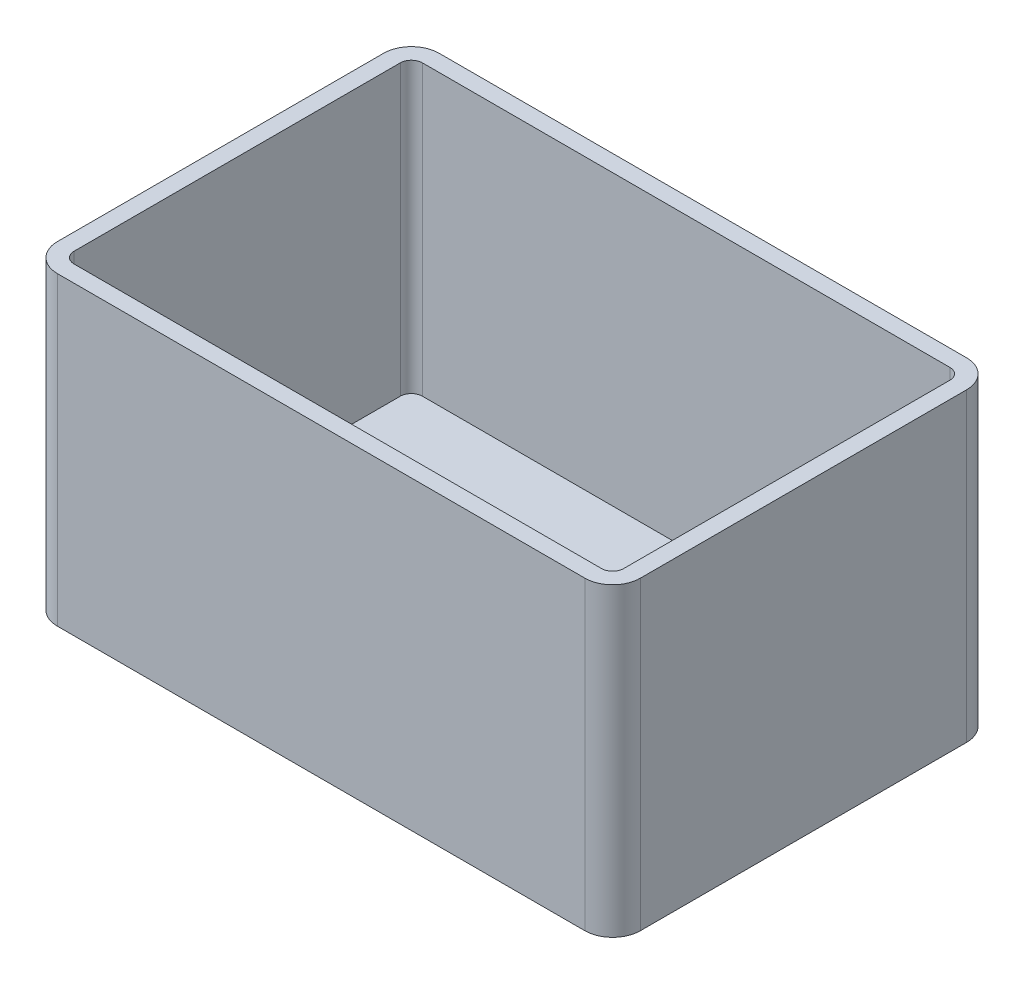
from build123d import *

# Parameters (mm, degrees)
BOSS_EXTRUDE1_DEPTH = 55
SHELL1_T            = -3


with BuildPart() as part:
    # Sketch2 → Boss-Extrude1 (new body)
    with BuildSketch(Plane(origin=(0, 0, 0), x_dir=(1, 0, 0), z_dir=(0, 1, 0))):
        with BuildLine():
            Line((47.5, -34.375), (-47.5, -34.375))
            ThreePointArc((-47.5, -34.375), (-51.035533906, -32.910533906), (-52.5, -29.375))
            Line((-52.5, -29.375), (-52.5, 29.375))
            ThreePointArc((-52.5, 29.375), (-51.035533906, 32.910533906), (-47.5, 34.375))
            Line((-47.5, 34.375), (47.5, 34.375))
            ThreePointArc((47.5, 34.375), (51.035533906, 32.910533906), (52.5, 29.375))
            Line((52.5, 29.375), (52.5, -29.375))
            ThreePointArc((52.5, -29.375), (51.035533906, -32.910533906), (47.5, -34.375))
        make_face()
    extrude(amount=BOSS_EXTRUDE1_DEPTH)

    # Shell1
    shell1_openings = [part.faces().sort_by_distance(p)[0] for p in [
        (0, 55, 0),
    ]]
    offset(amount=SHELL1_T, openings=shell1_openings, kind=Kind.INTERSECTION)


solid = part.part
